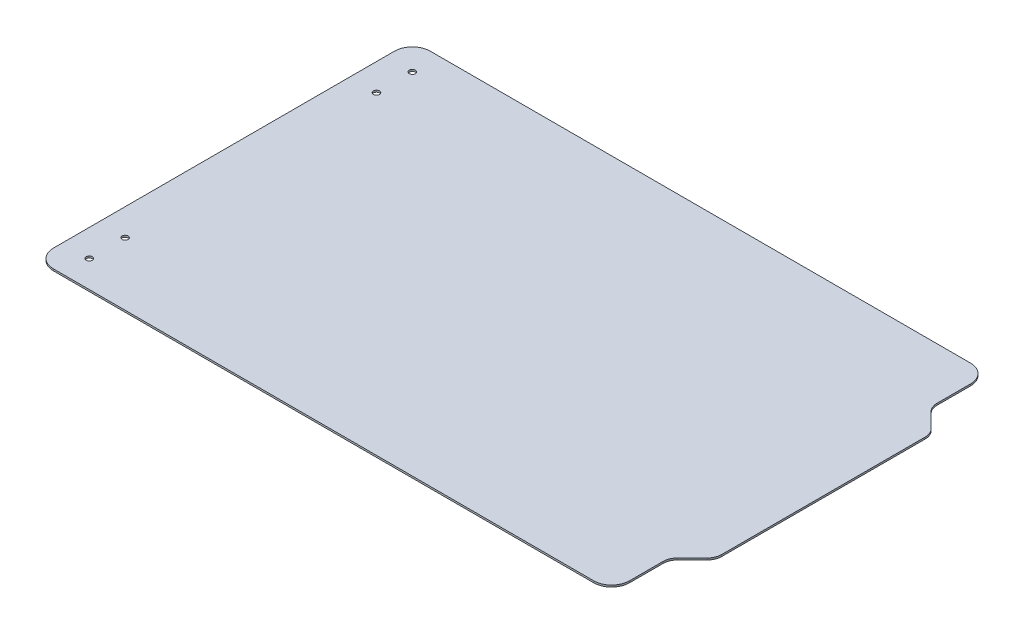
from build123d import *

# Parameters (mm, degrees)
SKETCH1_W           = 334
SKETCH1_H           = 210
BOSS_EXTRUDE1_DEPTH = 1
CUT_EXTRUDE1_DEPTH  = 198.268852078
FILLET1_R           = 8
FILLET2_R           = 10
SKETCH3_R           = 1.7
CUT_EXTRUDE2_DEPTH  = 198.268852078


with BuildPart() as part:
    # Sketch1 → Boss-Extrude1 (new body)
    with BuildSketch(Plane(origin=(0, 0, 0), x_dir=(1, 0, 0), z_dir=(0, 1, 0))):
        Rectangle(SKETCH1_W, SKETCH1_H)
    extrude(amount=BOSS_EXTRUDE1_DEPTH)

    # Sketch2 → Cut-Extrude1 (cut, through all)
    with BuildSketch(Plane(origin=(0, 0, 0), x_dir=(-1, 0, 0), z_dir=(0, -1, 0))):
        Polygon((-167, -60), (-154, -73), (-154, -105), (-167, -105), align=None)
        Polygon((-154, 105), (-167, 105), (-167, 60), (-154, 73), align=None)
    extrude(amount=-CUT_EXTRUDE1_DEPTH, mode=Mode.SUBTRACT)

    # Fillet1
    fillet1_edges = [part.edges().sort_by_distance(p)[0] for p in [
        (154, 0.5, -73),
        (167, 0.5, -60),
        (154, 0.5, 73),
        (167, 0.5, 60),
    ]]
    fillet(fillet1_edges, radius=FILLET1_R)

    # Fillet2
    fillet2_edges = [part.edges().sort_by_distance(p)[0] for p in [
        (154, 0.5, -105),
        (-167, 0.5, -105),
        (-167, 0.5, 105),
        (154, 0.5, 105),
    ]]
    fillet(fillet2_edges, radius=FILLET2_R)

    # Sketch3 → Cut-Extrude2 (cut, through all)
    with BuildSketch(Plane.XZ):
        with Locations((-152, -70)):
            Circle(SKETCH3_R)
        with Locations((-152, -90)):
            Circle(SKETCH3_R)
        with Locations((-152, 70)):
            Circle(SKETCH3_R)
        with Locations((-152, 90)):
            Circle(SKETCH3_R)
    extrude(amount=-CUT_EXTRUDE2_DEPTH, mode=Mode.SUBTRACT)


solid = part.part
